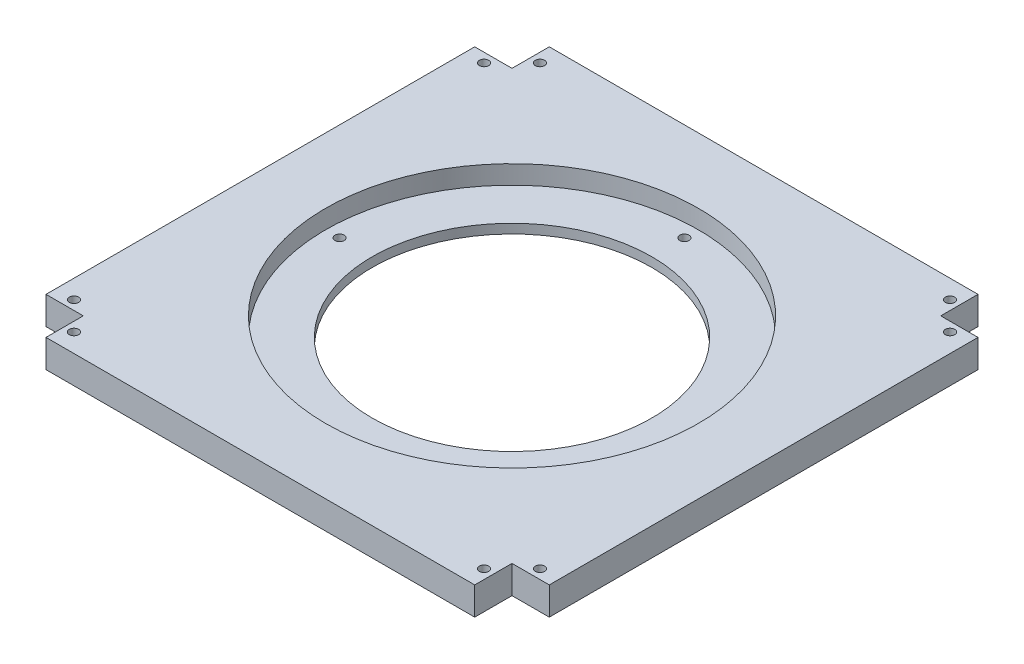
from build123d import *

# Parameters (mm, degrees)
SKETCH1_W           = 270
SKETCH1_H           = 270
BOSS_EXTRUDE1_DEPTH = 15
SKETCH8_W           = 20
SKETCH8_H           = 20
CUT_EXTRUDE1_DEPTH  = 383.132176086
SKETCH9_R           = 2.5
CUT_EXTRUDE2_DEPTH  = 383.132176086
SKETCH10_R          = 100
CUT_EXTRUDE3_DEPTH  = 10
SKETCH12_R          = 75
SKETCH12_R_2        = 2.5
CUT_EXTRUDE4_DEPTH  = 382.968585096


with BuildPart() as part:
    # Sketch1 → Boss-Extrude1 (new body)
    with BuildSketch(Plane(origin=(0, 0, 0), x_dir=(1, 0, 0), z_dir=(0, 1, 0))):
        with Locations((135, 135)):
            Rectangle(SKETCH1_W, SKETCH1_H)
    extrude(amount=BOSS_EXTRUDE1_DEPTH)

    # Sketch8 → Cut-Extrude1 (cut, through all)
    with BuildSketch(Plane(origin=(0, 15, 0), x_dir=(1, 0, 0), z_dir=(0, 1, 0))):
        with Locations((10, 260)):
            Rectangle(SKETCH8_W, SKETCH8_H)
        with Locations((260, 260)):
            Rectangle(SKETCH8_W, SKETCH8_H)
        with Locations((260, 10)):
            Rectangle(SKETCH8_W, SKETCH8_H)
        with Locations((10, 10)):
            Rectangle(SKETCH8_W, SKETCH8_H)
    extrude(amount=-CUT_EXTRUDE1_DEPTH, mode=Mode.SUBTRACT)

    # Sketch9 → Cut-Extrude2 (cut, through all)
    with BuildSketch(Plane(origin=(0, 15, 0), x_dir=(1, 0, 0), z_dir=(0, 1, 0))):
        with Locations((10, 245)):
            Circle(SKETCH9_R)
        with Locations((10, 25)):
            Circle(SKETCH9_R)
        with Locations((25, 10)):
            Circle(SKETCH9_R)
        with Locations((245, 10)):
            Circle(SKETCH9_R)
        with Locations((260, 25)):
            Circle(SKETCH9_R)
        with Locations((260, 245)):
            Circle(SKETCH9_R)
        with Locations((245, 260)):
            Circle(SKETCH9_R)
        with Locations((25, 260)):
            Circle(SKETCH9_R)
    extrude(amount=-CUT_EXTRUDE2_DEPTH, mode=Mode.SUBTRACT)

    # Sketch10 → Cut-Extrude3 (cut)
    with BuildSketch(Plane(origin=(0, 15, 0), x_dir=(1, 0, 0), z_dir=(0, 1, 0))):
        with Locations((135, 135)):
            Circle(SKETCH10_R)
    extrude(amount=-CUT_EXTRUDE3_DEPTH, mode=Mode.SUBTRACT)

    # Sketch12 → Cut-Extrude4 (cut, through all)
    with BuildSketch(Plane(origin=(0, 5, 0), x_dir=(1, 0, 0), z_dir=(0, 1, 0))):
        with Locations((135, 135)):
            Circle(SKETCH12_R)
        with Locations((135, 227.5)):
            Circle(SKETCH12_R_2)
        with Locations((227.5, 135)):
            Circle(SKETCH12_R_2)
        with Locations((135, 42.5)):
            Circle(SKETCH12_R_2)
        with Locations((42.5, 135)):
            Circle(SKETCH12_R_2)
    extrude(amount=-CUT_EXTRUDE4_DEPTH, mode=Mode.SUBTRACT)


solid = part.part
